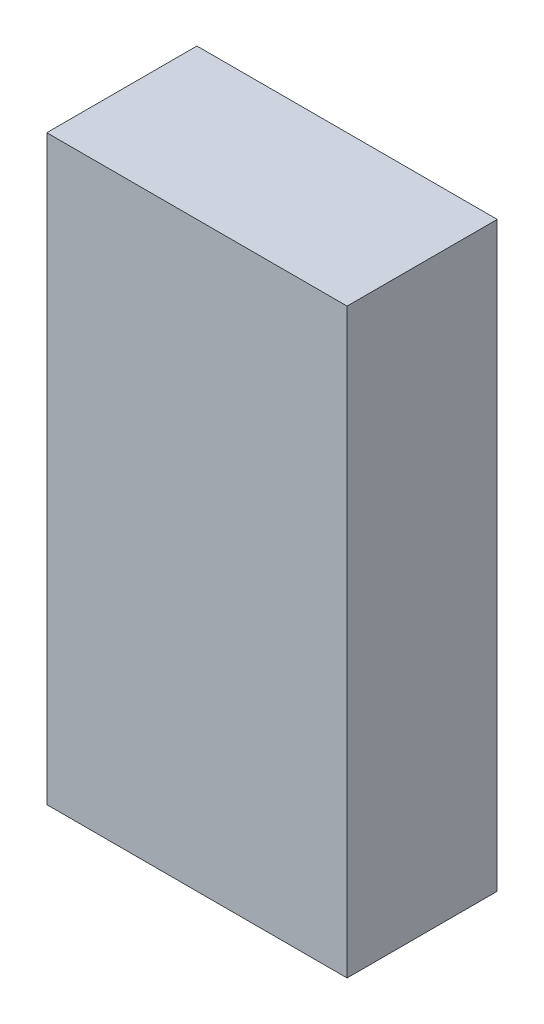
from build123d import *

# Parameters (mm, degrees)
SKETCH2_W           = 50.8
SKETCH2_H           = 25.4
BOSS_EXTRUDE1_DEPTH = 98.425
SKETCH4_R           = 2.667
CUT_EXTRUDE2_DEPTH  = 19.05
SKETCH5_R           = 4.826
CUT_EXTRUDE3_DEPTH  = 12.7


with BuildPart() as part:
    # Sketch2 → Boss-Extrude1 (new body)
    with BuildSketch(Plane(origin=(0, 0, 0), x_dir=(1, 0, 0), z_dir=(0, 1, 0))):
        with Locations((25.4, 12.7)):
            Rectangle(SKETCH2_W, SKETCH2_H)
    extrude(amount=BOSS_EXTRUDE1_DEPTH)

    # Sketch4 → Cut-Extrude2 (cut)
    with BuildSketch(Plane(origin=(0, 0, 0), x_dir=(-1, 0, 0), z_dir=(0, -1, 0))):
        with Locations((-12.7, 12.7)):
            Circle(SKETCH4_R)
        with Locations((-38.1, 12.7)):
            Circle(SKETCH4_R)
    extrude(amount=-CUT_EXTRUDE2_DEPTH, mode=Mode.SUBTRACT)

    # Sketch5 → Cut-Extrude3 (cut)
    with BuildSketch(Plane(origin=(0, 0, -25.4), x_dir=(-1, 0, 0), z_dir=(0, 0, -1))):
        with Locations((-25.4, 85.725)):
            Circle(SKETCH5_R)
    extrude(amount=-CUT_EXTRUDE3_DEPTH, mode=Mode.SUBTRACT)


solid = part.part
